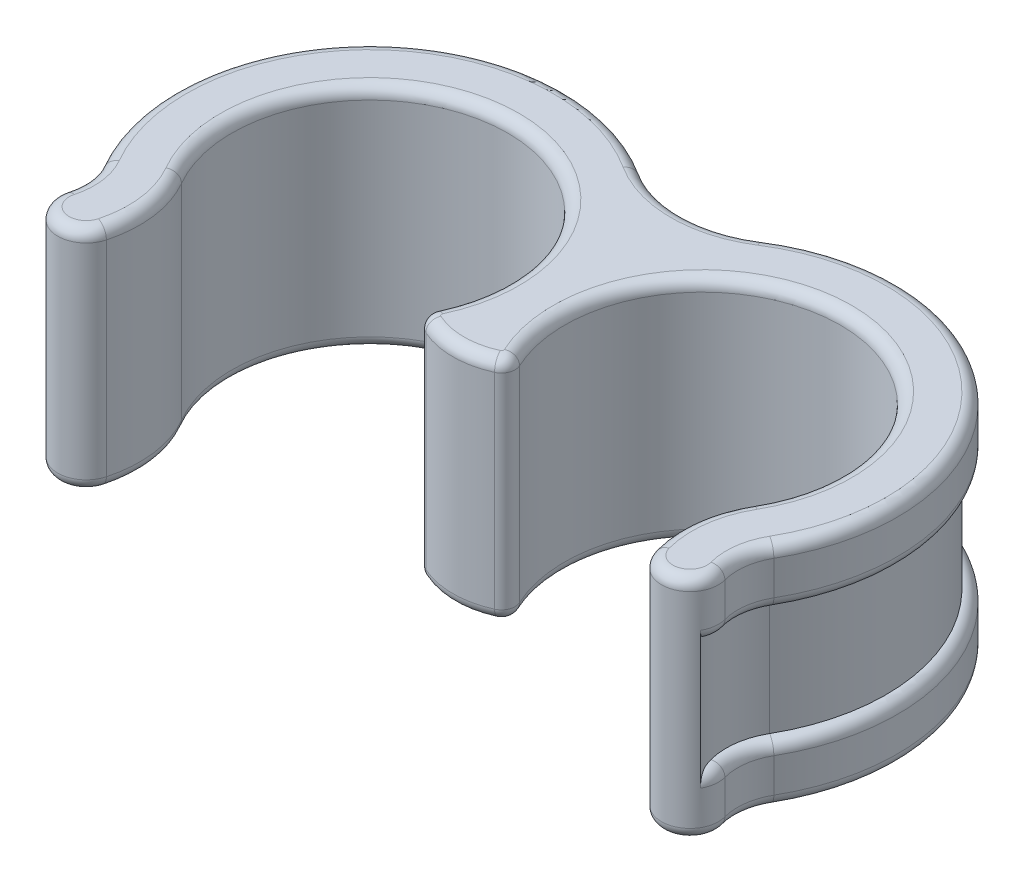
from build123d import *

# Parameters (mm, degrees)
BOSS_EXTRUDE1_DEPTH = 6.35
FILLET1_R           = 0.635
CUT_EXTRUDE1_DEPTH  = 3.175
FILLET2_R           = 0.635


with BuildPart() as part:
    # Sketch1 → Boss-Extrude1 (new, symmetric)
    with BuildSketch(Plane(origin=(0, 0, 0), x_dir=(1, 0, 0), z_dir=(0, 1, 0))):
        with BuildLine():
            ThreePointArc((15.92510619, -3.84175), (9.620682646, 7.675538697), (2.295137962, -3.220795101))
            ThreePointArc((2.295137962, -3.220795101), (2.31740567, -3.806147519), (1.917680508, -4.23434502))
            ThreePointArc((1.917680508, -4.23434502), (0, -4.648351996), (-1.917680508, -4.23434502))
            ThreePointArc((-1.917680508, -4.23434502), (-2.31740567, -3.806147519), (-2.295137962, -3.220795101))
            ThreePointArc((-2.295137962, -3.220795101), (-9.620682646, 7.675538697), (-15.92510619, -3.84175))
            ThreePointArc((-15.92510619, -3.84175), (-15.128692634, -6.187908679), (-15.290738507, -8.660250936))
            ThreePointArc((-15.290738507, -8.660250936), (-17.23502099, -9.782782952), (-18.357553006, -7.838500468))
            ThreePointArc((-18.357553006, -7.838500468), (-18.276530069, -6.60232934), (-18.674736847, -5.42925))
            ThreePointArc((-18.674736847, -5.42925), (-16.773064991, 7.850225673), (-3.42103321, 9.147945715))
            ThreePointArc((-3.42103321, 9.147945715), (0, 8.147621572), (3.42103321, 9.147945715))
            ThreePointArc((3.42103321, 9.147945715), (16.773064991, 7.850225673), (18.674736847, -5.42925))
            ThreePointArc((18.674736847, -5.42925), (18.276530069, -6.60232934), (18.357553006, -7.838500468))
            ThreePointArc((18.357553006, -7.838500468), (17.23502099, -9.782782952), (15.290738507, -8.660250936))
            ThreePointArc((15.290738507, -8.660250936), (15.128692634, -6.187908679), (15.92510619, -3.84175))
        make_face()
    extrude(amount=BOSS_EXTRUDE1_DEPTH, both=True)

    # Fillet1
    fillet1_edges = [part.edges().sort_by_distance(p)[0] for p in [
        (15.128692634, 6.35, 6.187908679),
        (0, -6.35, 4.648351996),
        (-2.31740567, -6.35, 3.806147519),
        (-9.620682646, -6.35, -7.675538697),
        (-15.128692634, -6.35, 6.187908679),
        (-17.23502099, -6.35, 9.782782952),
        (-18.276530069, -6.35, 6.60232934),
        (-16.773064991, -6.35, -7.850225673),
        (0, -6.35, -8.147621572),
        (17.23502099, 6.35, 9.782782952),
        (16.773064991, -6.35, -7.850225673),
        (18.276530069, -6.35, 6.60232934),
        (17.23502099, -6.35, 9.782782952),
        (15.128692634, -6.35, 6.187908679),
        (9.620682646, -6.35, -7.675538697),
        (2.31740567, -6.35, 3.806147519),
        (18.276530069, 6.35, 6.60232934),
        (16.773064991, 6.35, -7.850225673),
        (0, 6.35, -8.147621572),
        (-16.773064991, 6.35, -7.850225673),
        (-18.276530069, 6.35, 6.60232934),
        (-17.23502099, 6.35, 9.782782952),
        (-15.128692634, 6.35, 6.187908679),
        (-9.620682646, 6.35, -7.675538697),
        (2.31740567, 6.35, 3.806147519),
        (-2.31740567, 6.35, 3.806147519),
        (0, 6.35, 4.648351996),
        (9.620682646, 6.35, -7.675538697),
    ]]
    fillet(fillet1_edges, radius=FILLET1_R)

    # Sketch2 → Cut-Extrude1 (cut, symmetric)
    with BuildSketch(Plane(origin=(0, 0, 0), x_dir=(1, 0, 0), z_dir=(0, 1, 0))):
        with BuildLine():
            ThreePointArc((-18.19846693, -9.043980989), (-17.615035727, -7.088104139), (-18.124810716, -5.11175))
            ThreePointArc((-18.124810716, -5.11175), (-16.33434774, 7.391148148), (-3.763136531, 8.61297813))
            ThreePointArc((-3.763136531, 8.61297813), (0, 7.512621572), (3.763136531, 8.61297813))
            ThreePointArc((3.763136531, 8.61297813), (16.33434774, 7.391148148), (18.124810716, -5.11175))
            ThreePointArc((18.124810716, -5.11175), (17.615035727, -7.088104139), (18.19846693, -9.043980989))
            ThreePointArc((18.19846693, -9.043980989), (18.397999932, -8.457075686), (18.357553006, -7.838500468))
            ThreePointArc((18.357553006, -7.838500468), (18.276530069, -6.60232934), (18.674736847, -5.42925))
            ThreePointArc((18.674736847, -5.42925), (16.773064991, 7.850225673), (3.42103321, 9.147945715))
            ThreePointArc((3.42103321, 9.147945715), (0, 8.147621572), (-3.42103321, 9.147945715))
            ThreePointArc((-3.42103321, 9.147945715), (-16.773064991, 7.850225673), (-18.674736847, -5.42925))
            ThreePointArc((-18.674736847, -5.42925), (-18.276530069, -6.60232934), (-18.357553006, -7.838500468))
            ThreePointArc((-18.357553006, -7.838500468), (-18.397999932, -8.457075686), (-18.19846693, -9.043980989))
        make_face()
    extrude(amount=CUT_EXTRUDE1_DEPTH, both=True, mode=Mode.SUBTRACT)

    # Fillet2
    # the kernel refuses this fillet: 0.635 mm, written as the material it takes off along each edge
    with BuildSketch(Plane(origin=(-16.824145756, -3.175, 8.249375702), x_dir=(-0.9659258262890679, 0, -0.2588190451025219), z_dir=(0.2588190451025219, 0, -0.9659258262890679))) as fillet2_piece_1_section:
        with BuildLine():
            CenterArc((1.5875 - FILLET2_R, -FILLET2_R), FILLET2_R, 0, 90)
            Line((1.5875, -FILLET2_R), (1.5875, 0))
            Line((1.5875, 0), (1.5875 - FILLET2_R, 0))
        make_face()
    fillet2_piece_1 = revolve(axis=Axis((-16.824145756, -3.175, 8.249375702), (0, 1, 0)), revolution_arc=102.337192181, mode=Mode.PRIVATE)
    fillet2_piece_1 = fillet2_piece_1 & Plane(origin=(-21.424367504, -3.334227922, 7.01675), x_dir=(0.84669306412483, 0, 0.5320816245303972), z_dir=(0, 1, 0)) * Cylinder(3.81, 7, mode=Mode.PRIVATE)
    add(fillet2_piece_1, mode=Mode.SUBTRACT)
    with BuildSketch(Plane(origin=(-21.424367504, -3.175, 7.01675), x_dir=(0.8660254037844375, 0, -0.500000000000002), z_dir=(-0.500000000000002, 0, -0.8660254037844375))) as fillet2_piece_2:
        with BuildLine():
            CenterArc((3.175 + FILLET2_R, FILLET2_R), FILLET2_R, 180, 90)
            Line((3.175, FILLET2_R), (3.175, 0))
            Line((3.175, 0), (3.175 + FILLET2_R, 0))
        make_face()
    revolve(axis=Axis((-21.424367504, -3.175, 7.01675), (0, -1, 0)), revolution_arc=45, mode=Mode.SUBTRACT)
    with BuildSketch(Plane(origin=(-9.271, -3.175, 0), x_dir=(0.5387453874538747, 0, -0.8424686388805072), z_dir=(0.8424686388805072, 0, 0.5387453874538747))) as fillet2_piece_3:
        with BuildLine():
            CenterArc((10.8585 - FILLET2_R, -FILLET2_R), FILLET2_R, 0, 90)
            Line((10.8585, -FILLET2_R), (10.8585, 0))
            Line((10.8585, 0), (10.8585 - FILLET2_R, 0))
        make_face()
    revolve(axis=Axis((-9.271, -3.175, 0), (0, 1, 0)), revolution_arc=152.598272711, mode=Mode.SUBTRACT)
    with BuildSketch(Plane(origin=(0, -3.175, -14.497621572), x_dir=(0.5387453874538746, 0, 0.8424686388805073), z_dir=(0.8424686388805073, 0, -0.5387453874538746))) as fillet2_piece_4:
        with BuildLine():
            CenterArc((6.35 + FILLET2_R, FILLET2_R), FILLET2_R, 180, 90)
            Line((6.35, FILLET2_R), (6.35, 0))
            Line((6.35, 0), (6.35 + FILLET2_R, 0))
        make_face()
    revolve(axis=Axis((0, -3.175, -14.497621572), (0, -1, 0)), revolution_arc=65.196545422, mode=Mode.SUBTRACT)
    with BuildSketch(Plane(origin=(9.271, -3.175, 0), x_dir=(0.866025403784438, 0, 0.500000000000001), z_dir=(-0.500000000000001, 0, 0.866025403784438))) as fillet2_piece_5:
        with BuildLine():
            CenterArc((10.8585 - FILLET2_R, -FILLET2_R), FILLET2_R, 0, 90)
            Line((10.8585 - FILLET2_R, 0), (10.8585, 0))
            Line((10.8585, 0), (10.8585, -FILLET2_R))
        make_face()
    revolve(axis=Axis((9.271, -3.175, 0), (0, 1, 0)), revolution_arc=152.598272711, mode=Mode.SUBTRACT)
    with BuildSketch(Plane(origin=(21.424367504, -3.175, 7.01675), x_dir=(-0.9659258262890693, 0, 0.2588190451025171), z_dir=(0.2588190451025171, 0, 0.9659258262890693))) as fillet2_piece_6:
        with BuildLine():
            CenterArc((3.175 + FILLET2_R, FILLET2_R), FILLET2_R, 180, 90)
            Line((3.175 + FILLET2_R, 0), (3.175, 0))
            Line((3.175, 0), (3.175, FILLET2_R))
        make_face()
    revolve(axis=Axis((21.424367504, -3.175, 7.01675), (0, -1, 0)), revolution_arc=45, mode=Mode.SUBTRACT)
    with BuildSketch(Plane(origin=(16.824145756, -3.175, 8.249375702), x_dir=(0.046458035422521964, 0, 0.9989202425342474), z_dir=(-0.9989202425342474, 0, 0.046458035422521964))) as fillet2_piece_7_section:
        with BuildLine():
            CenterArc((1.5875 - FILLET2_R, -FILLET2_R), FILLET2_R, 0, 90)
            Line((1.5875, -FILLET2_R), (1.5875, 0))
            Line((1.5875, 0), (1.5875 - FILLET2_R, 0))
        make_face()
    fillet2_piece_7 = revolve(axis=Axis((16.824145756, -3.175, 8.249375702), (0, 1, 0)), revolution_arc=102.337192181, mode=Mode.PRIVATE)
    fillet2_piece_7 = fillet2_piece_7 & Plane(origin=(21.424367504, -3.334227929, 7.01675), x_dir=(-0.8660254037844396, 0, -0.49999999999999833), z_dir=(0, 1, 0)) * Cylinder(3.81, 7, mode=Mode.PRIVATE)
    add(fillet2_piece_7, mode=Mode.SUBTRACT)
    with BuildSketch(Plane(origin=(16.824145756, 3.175, 8.249375702), x_dir=(0.046458035422521964, 0, 0.9989202425342474), z_dir=(-0.9989202425342474, 0, 0.046458035422521964))) as fillet2_piece_8_section:
        with BuildLine():
            CenterArc((1.5875 - FILLET2_R, FILLET2_R), FILLET2_R, 270, 90)
            Line((1.5875 - FILLET2_R, 0), (1.5875, 0))
            Line((1.5875, 0), (1.5875, FILLET2_R))
        make_face()
    fillet2_piece_8 = revolve(axis=Axis((16.824145756, 3.175, 8.249375702), (0, 1, 0)), revolution_arc=102.337192181, mode=Mode.PRIVATE)
    fillet2_piece_8 = fillet2_piece_8 & Plane(origin=(21.424367504, 3.334227929, 7.01675), x_dir=(-0.8660254037844396, 0, -0.49999999999999833), z_dir=(0, 1, 0)) * Cylinder(3.81, 7, mode=Mode.PRIVATE)
    add(fillet2_piece_8, mode=Mode.SUBTRACT)
    with BuildSketch(Plane(origin=(21.424367504, 3.175, 7.01675), x_dir=(-0.9659258262890693, 0, 0.2588190451025171), z_dir=(0.2588190451025171, 0, 0.9659258262890693))) as fillet2_piece_9:
        with BuildLine():
            CenterArc((3.175 + FILLET2_R, -FILLET2_R), FILLET2_R, 90, 90)
            Line((3.175, -FILLET2_R), (3.175, 0))
            Line((3.175, 0), (3.175 + FILLET2_R, 0))
        make_face()
    revolve(axis=Axis((21.424367504, 3.175, 7.01675), (0, -1, 0)), revolution_arc=45, mode=Mode.SUBTRACT)
    with BuildSketch(Plane(origin=(9.271, 3.175, 0), x_dir=(0.866025403784438, 0, 0.500000000000001), z_dir=(-0.500000000000001, 0, 0.866025403784438))) as fillet2_piece_10:
        with BuildLine():
            CenterArc((10.8585 - FILLET2_R, FILLET2_R), FILLET2_R, 270, 90)
            Line((10.8585, FILLET2_R), (10.8585, 0))
            Line((10.8585, 0), (10.8585 - FILLET2_R, 0))
        make_face()
    revolve(axis=Axis((9.271, 3.175, 0), (0, 1, 0)), revolution_arc=152.598272711, mode=Mode.SUBTRACT)
    with BuildSketch(Plane(origin=(0, 3.175, -14.497621572), x_dir=(0.5387453874538746, 0, 0.8424686388805073), z_dir=(0.8424686388805073, 0, -0.5387453874538746))) as fillet2_piece_11:
        with BuildLine():
            CenterArc((6.35 + FILLET2_R, -FILLET2_R), FILLET2_R, 90, 90)
            Line((6.35, -FILLET2_R), (6.35, 0))
            Line((6.35, 0), (6.35 + FILLET2_R, 0))
        make_face()
    revolve(axis=Axis((0, 3.175, -14.497621572), (0, -1, 0)), revolution_arc=65.196545422, mode=Mode.SUBTRACT)
    with BuildSketch(Plane(origin=(-9.271, 3.175, 0), x_dir=(0.5387453874538747, 0, -0.8424686388805072), z_dir=(0.8424686388805072, 0, 0.5387453874538747))) as fillet2_piece_12:
        with BuildLine():
            CenterArc((10.8585 - FILLET2_R, FILLET2_R), FILLET2_R, 270, 90)
            Line((10.8585, FILLET2_R), (10.8585, 0))
            Line((10.8585, 0), (10.8585 - FILLET2_R, 0))
        make_face()
    revolve(axis=Axis((-9.271, 3.175, 0), (0, 1, 0)), revolution_arc=152.598272711, mode=Mode.SUBTRACT)
    with BuildSketch(Plane(origin=(-21.424367504, 3.175, 7.01675), x_dir=(0.8660254037844375, 0, -0.500000000000002), z_dir=(-0.500000000000002, 0, -0.8660254037844375))) as fillet2_piece_13:
        with BuildLine():
            CenterArc((3.175 + FILLET2_R, -FILLET2_R), FILLET2_R, 90, 90)
            Line((3.175, -FILLET2_R), (3.175, 0))
            Line((3.175, 0), (3.175 + FILLET2_R, 0))
        make_face()
    revolve(axis=Axis((-21.424367504, 3.175, 7.01675), (0, -1, 0)), revolution_arc=45, mode=Mode.SUBTRACT)
    with BuildSketch(Plane(origin=(-16.824145756, 3.175, 8.249375702), x_dir=(-0.9659258262890679, 0, -0.2588190451025219), z_dir=(0.2588190451025219, 0, -0.9659258262890679))) as fillet2_piece_14_section:
        with BuildLine():
            CenterArc((1.5875 - FILLET2_R, FILLET2_R), FILLET2_R, 270, 90)
            Line((1.5875 - FILLET2_R, 0), (1.5875, 0))
            Line((1.5875, 0), (1.5875, FILLET2_R))
        make_face()
    fillet2_piece_14 = revolve(axis=Axis((-16.824145756, 3.175, 8.249375702), (0, 1, 0)), revolution_arc=102.337192181, mode=Mode.PRIVATE)
    fillet2_piece_14 = fillet2_piece_14 & Plane(origin=(-21.424367504, 3.334227922, 7.01675), x_dir=(0.84669306412483, 0, 0.5320816245303972), z_dir=(0, 1, 0)) * Cylinder(3.81, 7, mode=Mode.PRIVATE)
    add(fillet2_piece_14, mode=Mode.SUBTRACT)


solid = part.part
